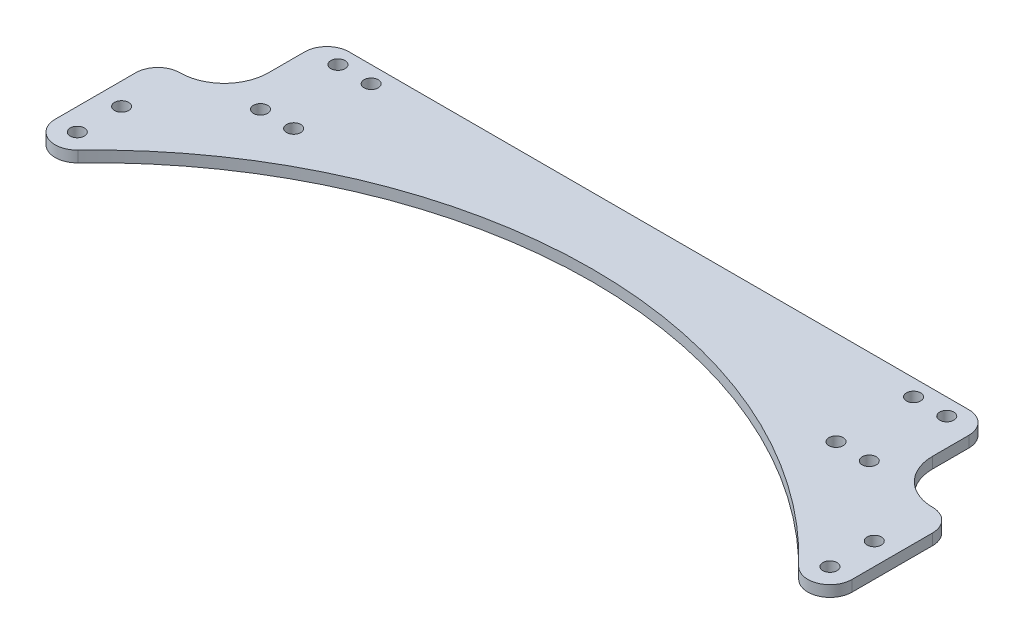
from build123d import *
from OCP.BRepFilletAPI import BRepFilletAPI_MakeFillet

# Parameters (mm, degrees)
BOSS_EXTRUDE1_DEPTH = 3.175
SKETCH3_R           = 2.032
CUT_EXTRUDE1_DEPTH  = 241.986473946
FILLET1_R           = 6.35
SKETCH4_R           = 2.032
SKETCH4_W           = 19.05
SKETCH4_H           = 29.448186152
CUT_EXTRUDE2_DEPTH  = 241.986473946
FILLET2_R           = 12.7
FILLET2_R_2         = 6.35


with BuildPart() as part:
    # Sketch1 → Boss-Extrude1 (new body)
    with BuildSketch(Plane(origin=(0, 0, 0), x_dir=(1, 0, 0), z_dir=(0, 1, 0))):
        with BuildLine():
            Line((0, 0), (0, 76.2))
            Line((0, 76.2), (228.6, 76.2))
            Line((228.6, 76.2), (228.6, 0))
            ThreePointArc((228.6, 0), (114.3, 57.15), (0, 0))
        make_face()
    extrude(amount=BOSS_EXTRUDE1_DEPTH)

    # Sketch3 → Cut-Extrude1 (cut, through all)
    with BuildSketch(Plane.XZ):
        with Locations(Location((36.5125, -49.2125, 0), (0, 0, 270))):
            Circle(SKETCH3_R)
        with Locations(Location((26.9875, -49.2125, 0), (0, 0, 270))):
            Circle(SKETCH3_R)
        with Locations(Location((201.6125, -49.2125, 0), (0, 0, 90))):
            Circle(SKETCH3_R)
        with Locations(Location((192.0875, -49.2125, 0), (0, 0, 90))):
            Circle(SKETCH3_R)
        with Locations(Location((36.5125, -71.4375, 0), (0, 0, 270))):
            Circle(SKETCH3_R)
        with Locations(Location((26.9875, -71.4375, 0), (0, 0, 270))):
            Circle(SKETCH3_R)
        with Locations(Location((201.6125, -71.4375, 0), (0, 0, 90))):
            Circle(SKETCH3_R)
        with Locations(Location((192.0875, -71.4375, 0), (0, 0, 90))):
            Circle(SKETCH3_R)
    extrude(amount=-CUT_EXTRUDE1_DEPTH, mode=Mode.SUBTRACT)

    # Fillet1
    fillet1_edges = [part.edges().sort_by_distance(p)[0] for p in [
        (0, 1.5875, 0),
        (228.6, 1.5875, 0),
    ]]
    fillet(fillet1_edges, radius=FILLET1_R)

    # Sketch4 → Cut-Extrude2 (cut, through all)
    with BuildSketch(Plane.XZ):
        with Locations(Location((6.35, -17.303627696, 0), (0, 0, 270))):
            Circle(SKETCH4_R)
        with Locations(Location((6.35, -30.003627696, 0), (0, 0, 270))):
            Circle(SKETCH4_R)
        with Locations(Location((222.25, -17.303627696, 0), (0, 0, 270))):
            Circle(SKETCH4_R)
        with Locations(Location((222.25, -30.003627696, 0), (0, 0, 270))):
            Circle(SKETCH4_R)
        with Locations((9.525, -61.475906924)):
            Rectangle(SKETCH4_W, SKETCH4_H)
        with Locations((219.075, -61.475906924)):
            Rectangle(SKETCH4_W, SKETCH4_H)
    extrude(amount=-CUT_EXTRUDE2_DEPTH, mode=Mode.SUBTRACT)

    # Fillet2
    fillet2_edges_1 = [part.edges().sort_by_distance(p)[0] for p in [
        (209.55, 1.5875, -46.751813848),
        (19.05, 1.5875, -46.751813848),
    ]]
    fillet2_edges_2 = [part.edges().sort_by_distance(p)[0] for p in [
        (228.6, 1.5875, -46.751813848),
        (209.55, 1.5875, -76.2),
        (0, 1.5875, -46.751813848),
        (19.05, 1.5875, -76.2),
    ]]
    fillet2 = BRepFilletAPI_MakeFillet(part.part.solid().wrapped)
    for e in fillet2_edges_1:
        fillet2.Add(FILLET2_R - 0.0001, e.wrapped)
    for e in fillet2_edges_2:
        fillet2.Add(FILLET2_R_2 - 0.0001, e.wrapped)
    add(Compound.cast(fillet2.Shape()), mode=Mode.REPLACE)  # a hair under: the kernel refuses the full size


solid = part.part
